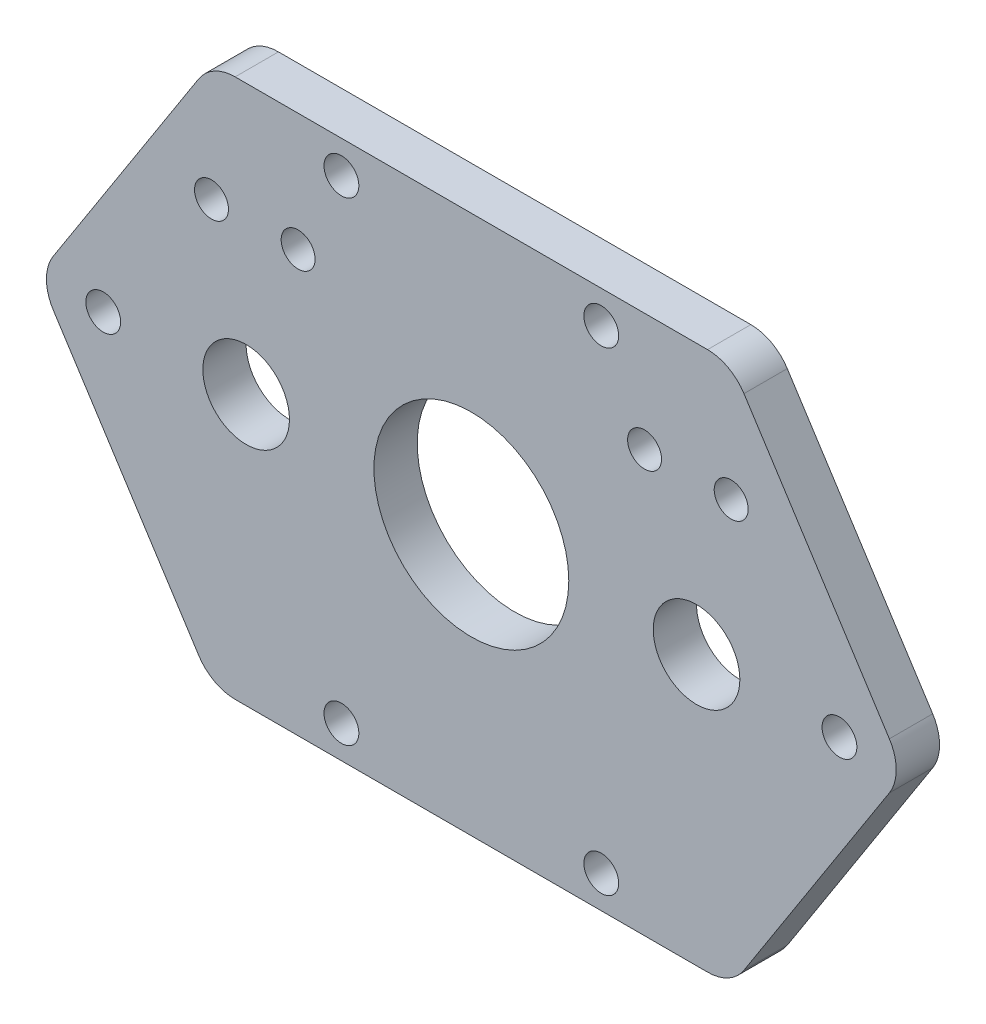
from build123d import *

# Parameters (mm, degrees)
SKETCH5_R           = 6.35
SKETCH5_R_2         = 2.4892
SKETCH5_R_3         = 2.5527
SKETCH5_R_4         = 14.2875
BOSS_EXTRUDE1_DEPTH = 6.35
FILLET2_R           = 6.35


with BuildPart() as part:
    # Sketch5 → Boss-Extrude1 (new body)
    with BuildSketch(Plane.XY):
        Polygon((38.1, 39.52494), (-38.1, 39.52494), (-63.5, 0), (-38.1, -39.52494), (38.1, -39.52494), (63.5, 0), align=None)
        with Locations((-33.02, 0)):
            Circle(SKETCH5_R, mode=Mode.SUBTRACT)
        with Locations((-38.1, 22.225)):
            Circle(SKETCH5_R_2, mode=Mode.SUBTRACT)
        with Locations((38.1, 22.225)):
            Circle(SKETCH5_R_2, mode=Mode.SUBTRACT)
        with Locations((33.02, 0)):
            Circle(SKETCH5_R, mode=Mode.SUBTRACT)
        with Locations((-19.05, -34.76244)):
            Circle(SKETCH5_R_3, mode=Mode.SUBTRACT)
        with Locations((19.05, -34.76244)):
            Circle(SKETCH5_R_3, mode=Mode.SUBTRACT)
        with Locations((-25.4, 22.225)):
            Circle(SKETCH5_R_2, mode=Mode.SUBTRACT)
        with Locations((-19.05, 34.76244)):
            Circle(SKETCH5_R_3, mode=Mode.SUBTRACT)
        Circle(SKETCH5_R_4, mode=Mode.SUBTRACT)
        with Locations((25.4, 22.225)):
            Circle(SKETCH5_R_2, mode=Mode.SUBTRACT)
        with Locations((19.05, 34.76244)):
            Circle(SKETCH5_R_3, mode=Mode.SUBTRACT)
        with Locations((-53.975, 0)):
            Circle(SKETCH5_R_3, mode=Mode.SUBTRACT)
        with Locations((53.975, 0)):
            Circle(SKETCH5_R_3, mode=Mode.SUBTRACT)
    extrude(amount=BOSS_EXTRUDE1_DEPTH)

    # Fillet2
    fillet2_edges = [part.edges().sort_by_distance(p)[0] for p in [
        (38.1, -39.52494, 3.175),
        (-38.1, -39.52494, 3.175),
        (38.1, 39.52494, 3.175),
        (-38.1, 39.52494, 3.175),
        (63.5, 0, 3.175),
        (-63.5, 0, 3.175),
    ]]
    fillet(fillet2_edges, radius=FILLET2_R)


solid = part.part
